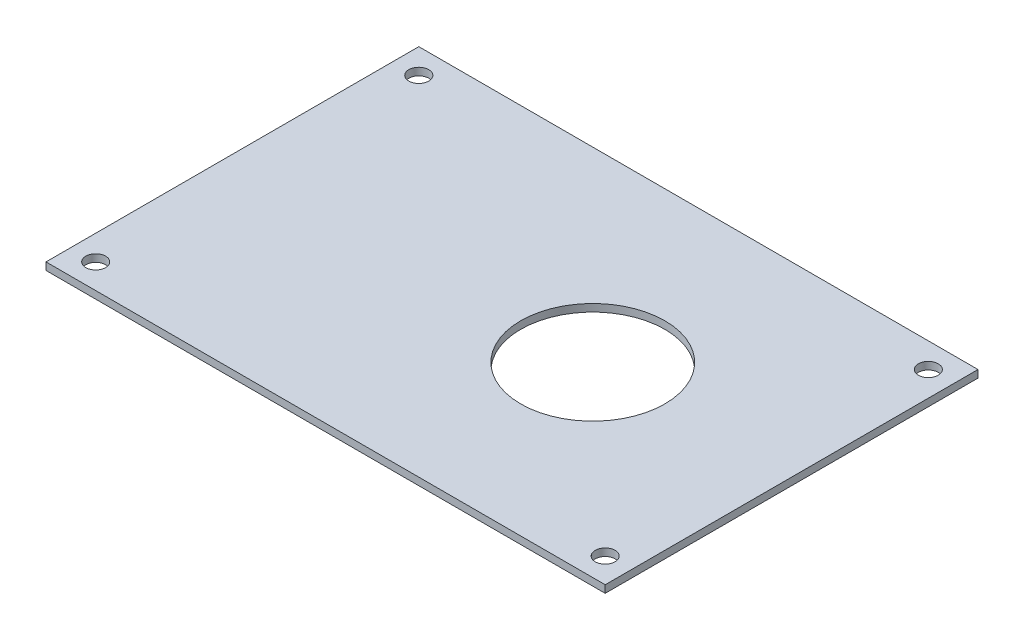
from build123d import *

# Parameters (mm, degrees)
SKETCH1_W           = 225
SKETCH1_H           = 150
BOSS_EXTRUDE1_DEPTH = 3
SKETCH2_R           = 4
CUT_EXTRUDE1_DEPTH  = 3
SKETCH3_R           = 29
CUT_EXTRUDE2_DEPTH  = 3


with BuildPart() as part:
    # Sketch1 → Boss-Extrude1 (new body)
    with BuildSketch(Plane(origin=(0, 0, 0), x_dir=(1, 0, 0), z_dir=(0, 1, 0))):
        Rectangle(SKETCH1_W, SKETCH1_H)
    extrude(amount=BOSS_EXTRUDE1_DEPTH)

    # Sketch2 → Cut-Extrude1 (cut)
    with BuildSketch(Plane(origin=(0, 3, 0), x_dir=(1, 0, 0), z_dir=(0, 1, 0))):
        with Locations((-102.5, -65)):
            Circle(SKETCH2_R)
        with Locations((-102.5, 65)):
            Circle(SKETCH2_R)
        with Locations((102.5, -65)):
            Circle(SKETCH2_R)
        with Locations((102.5, 65)):
            Circle(SKETCH2_R)
    extrude(amount=-CUT_EXTRUDE1_DEPTH, mode=Mode.SUBTRACT)

    # Sketch3 → Cut-Extrude2 (cut)
    with BuildSketch(Plane(origin=(0, 3, 0), x_dir=(1, 0, 0), z_dir=(0, 1, 0))):
        with Locations((32.5, 0)):
            Circle(SKETCH3_R)
    extrude(amount=-CUT_EXTRUDE2_DEPTH, mode=Mode.SUBTRACT)


solid = part.part
